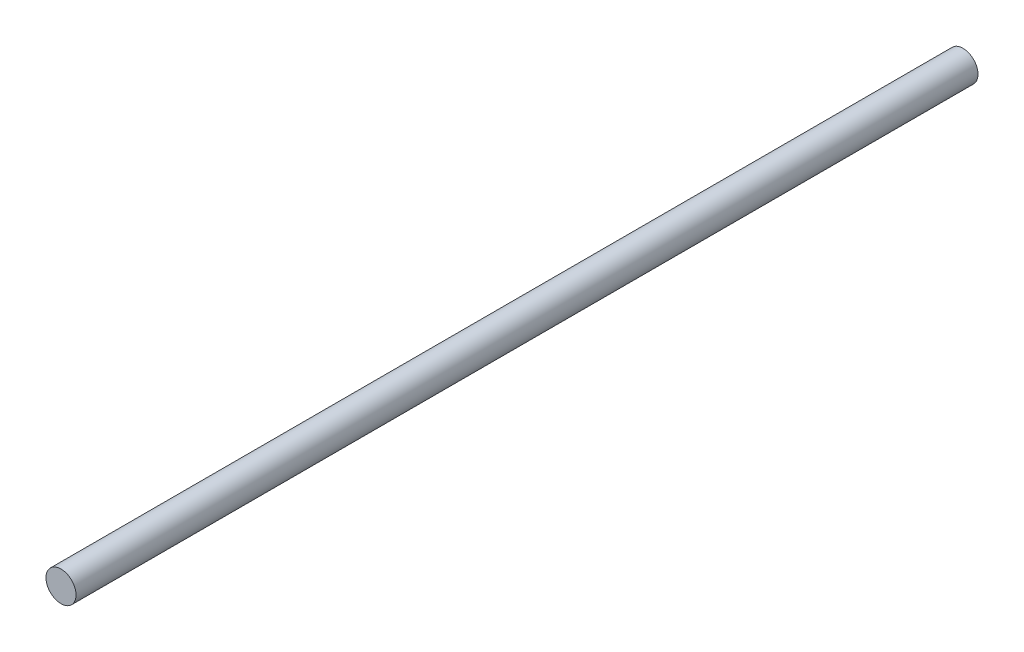
from build123d import *

# Parameters (mm, degrees)
SKETCH1_R           = 1.5875
BOSS_EXTRUDE1_DEPTH = 95.25


with BuildPart() as part:
    # Sketch1 → Boss-Extrude1 (new body)
    with BuildSketch(Plane.XY):
        Circle(SKETCH1_R)
    extrude(amount=BOSS_EXTRUDE1_DEPTH)


solid = part.part
